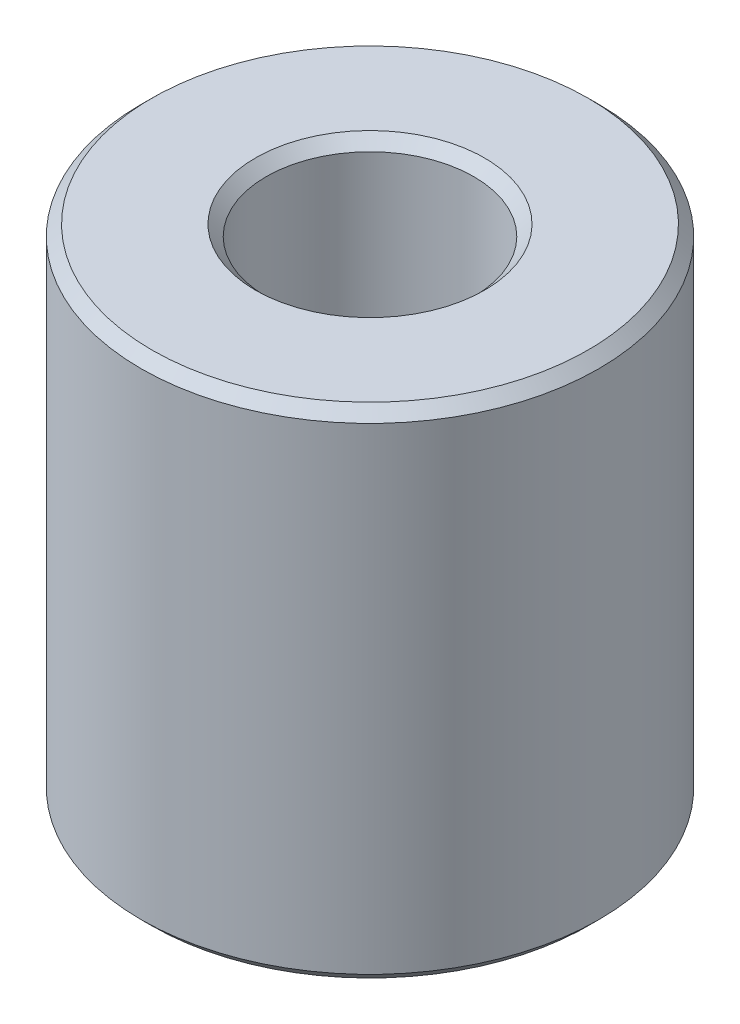
from build123d import *

# Parameters (mm, degrees)
SKETCH1_R           = 25
BOSS_EXTRUDE1_DEPTH = 54.462744785
SKETCH2_R           = 11.338136296
CUT_EXTRUDE1_DEPTH  = 65.93219979
CHAMFER1_SIZE       = 1.176951448


with BuildPart() as part:
    # Sketch1 → Boss-Extrude1 (new body)
    with BuildSketch(Plane(origin=(0, 0, 0), x_dir=(1, 0, 0), z_dir=(0, 1, 0))):
        Circle(SKETCH1_R)
    extrude(amount=BOSS_EXTRUDE1_DEPTH)

    # Sketch2 → Cut-Extrude1 (cut, through all)
    with BuildSketch(Plane(origin=(0, 0, 0), x_dir=(1, 0, 0), z_dir=(0, 1, 0))):
        Circle(SKETCH2_R)
    extrude(amount=CUT_EXTRUDE1_DEPTH, mode=Mode.SUBTRACT)

    # Chamfer1
    chamfer1_edges = [part.edges().sort_by_distance(p)[0] for p in [
        (-11.338136296, 54.462744785, 0),
        (-11.338136296, 0, 0),
        (-25, 0, 0),
        (-25, 54.462744785, 0),
    ]]
    chamfer(chamfer1_edges, length=CHAMFER1_SIZE)


solid = part.part
